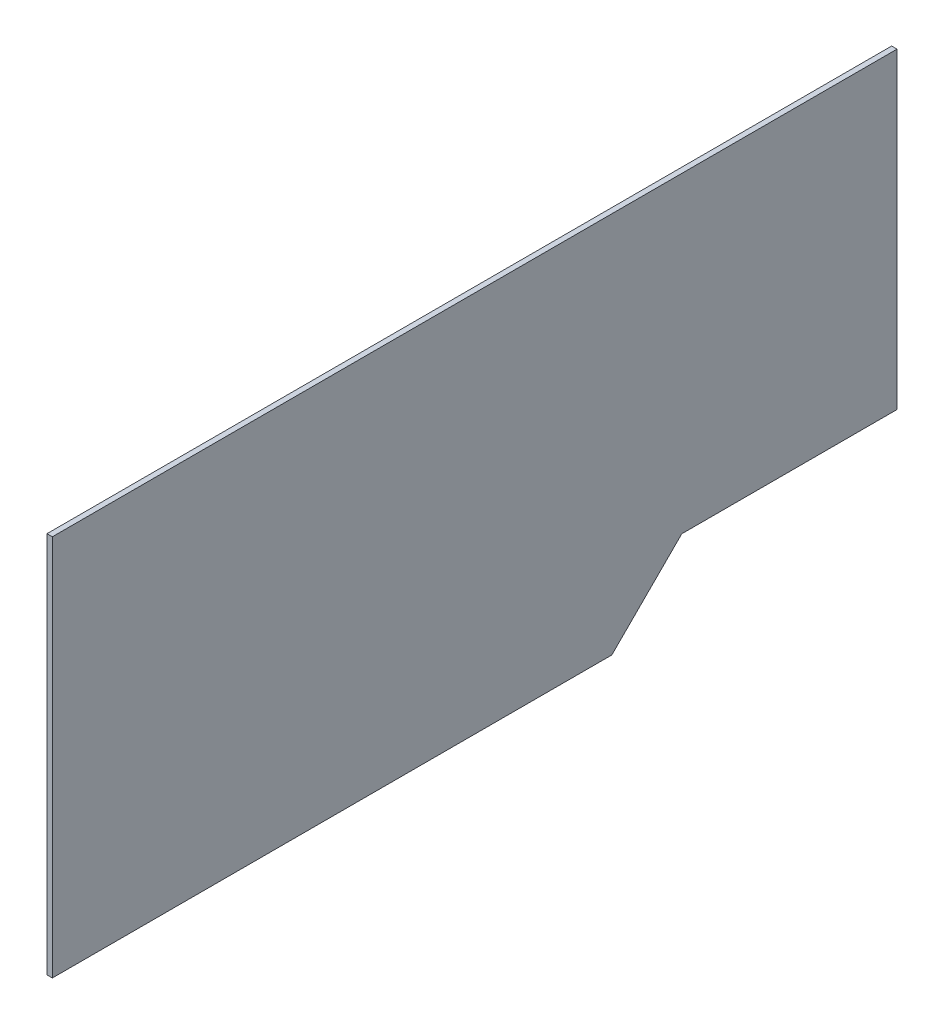
from build123d import *

# Parameters (mm, degrees)
SKETCH1_W           = 498.348
SKETCH1_H           = 177.8
BOSS_EXTRUDE1_DEPTH = 1.5875
BOSS_EXTRUDE2_DEPTH = 3.175


with BuildPart() as part:
    # Sketch1 → Boss-Extrude1 (new, symmetric)
    with BuildSketch(Plane(origin=(0, 0, 0), x_dir=(0, 0, -1), z_dir=(1, 0, 0))):
        Rectangle(SKETCH1_W, SKETCH1_H)
    extrude(amount=BOSS_EXTRUDE1_DEPTH, both=True)

    # Sketch2 → Boss-Extrude2 (add)
    with BuildSketch(Plane(origin=(1.5875, 0, 0), x_dir=(0, 0, -1), z_dir=(1, 0, 0))):
        Polygon((249.174, -95.25), (249.174, -88.9), (-249.174, -88.9), (-249.174, -136.525), (80.899, -136.525), (122.174, -95.25), align=None)
    extrude(amount=-BOSS_EXTRUDE2_DEPTH)


solid = part.part
